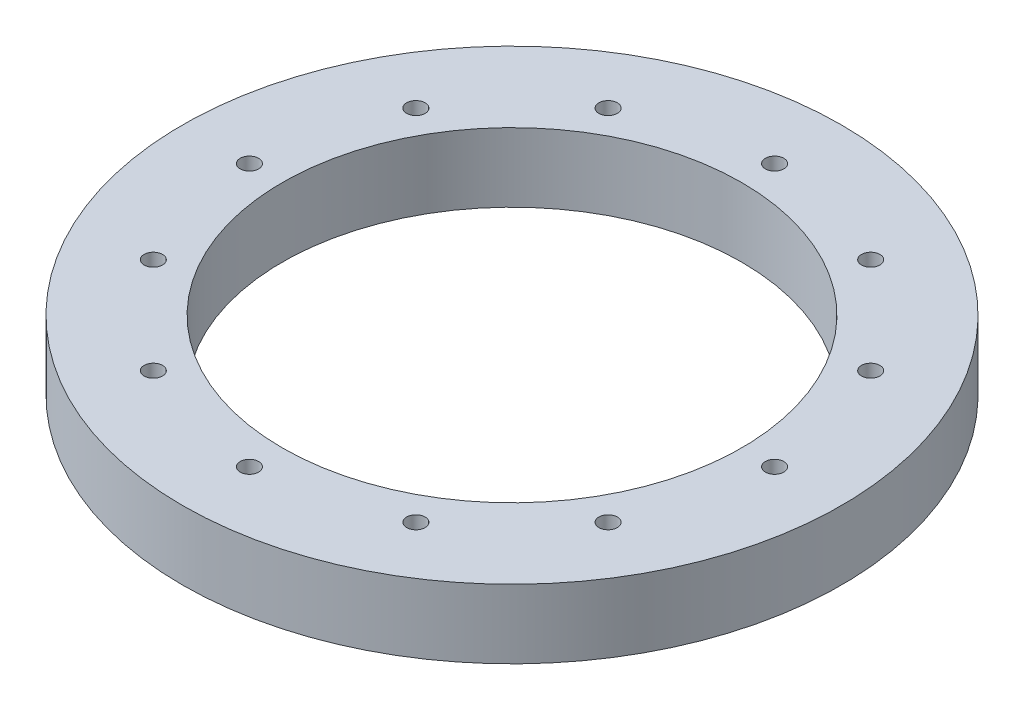
from build123d import *

# Parameters (mm, degrees)
SKETCH1_R           = 127.508
SKETCH1_R_2         = 88.9
SKETCH1_R_3         = 3.5687
BOSS_EXTRUDE1_DEPTH = 26.67


with BuildPart() as part:
    # Sketch1 → Boss-Extrude1 (new body)
    with BuildSketch(Plane(origin=(0, 0, 0), x_dir=(1, 0, 0), z_dir=(0, 1, 0))):
        Circle(SKETCH1_R)
        Circle(SKETCH1_R_2, mode=Mode.SUBTRACT)
        with Locations((0, 101.6)):
            Circle(SKETCH1_R_3, mode=Mode.SUBTRACT)
        with Locations((50.8, 87.988181024)):
            Circle(SKETCH1_R_3, mode=Mode.SUBTRACT)
        with Locations((87.988181025, 50.8)):
            Circle(SKETCH1_R_3, mode=Mode.SUBTRACT)
        with Locations((101.6, 0)):
            Circle(SKETCH1_R_3, mode=Mode.SUBTRACT)
        with Locations((87.988181025, -50.8)):
            Circle(SKETCH1_R_3, mode=Mode.SUBTRACT)
        with Locations((50.8, -87.988181024)):
            Circle(SKETCH1_R_3, mode=Mode.SUBTRACT)
        with Locations((0, -101.6)):
            Circle(SKETCH1_R_3, mode=Mode.SUBTRACT)
        with Locations((-50.8, -87.988181025)):
            Circle(SKETCH1_R_3, mode=Mode.SUBTRACT)
        with Locations((-87.988181024, -50.8)):
            Circle(SKETCH1_R_3, mode=Mode.SUBTRACT)
        with Locations((-101.6, 0)):
            Circle(SKETCH1_R_3, mode=Mode.SUBTRACT)
        with Locations((-87.988181024, 50.8)):
            Circle(SKETCH1_R_3, mode=Mode.SUBTRACT)
        with Locations((-50.8, 87.988181024)):
            Circle(SKETCH1_R_3, mode=Mode.SUBTRACT)
    extrude(amount=BOSS_EXTRUDE1_DEPTH)


solid = part.part
